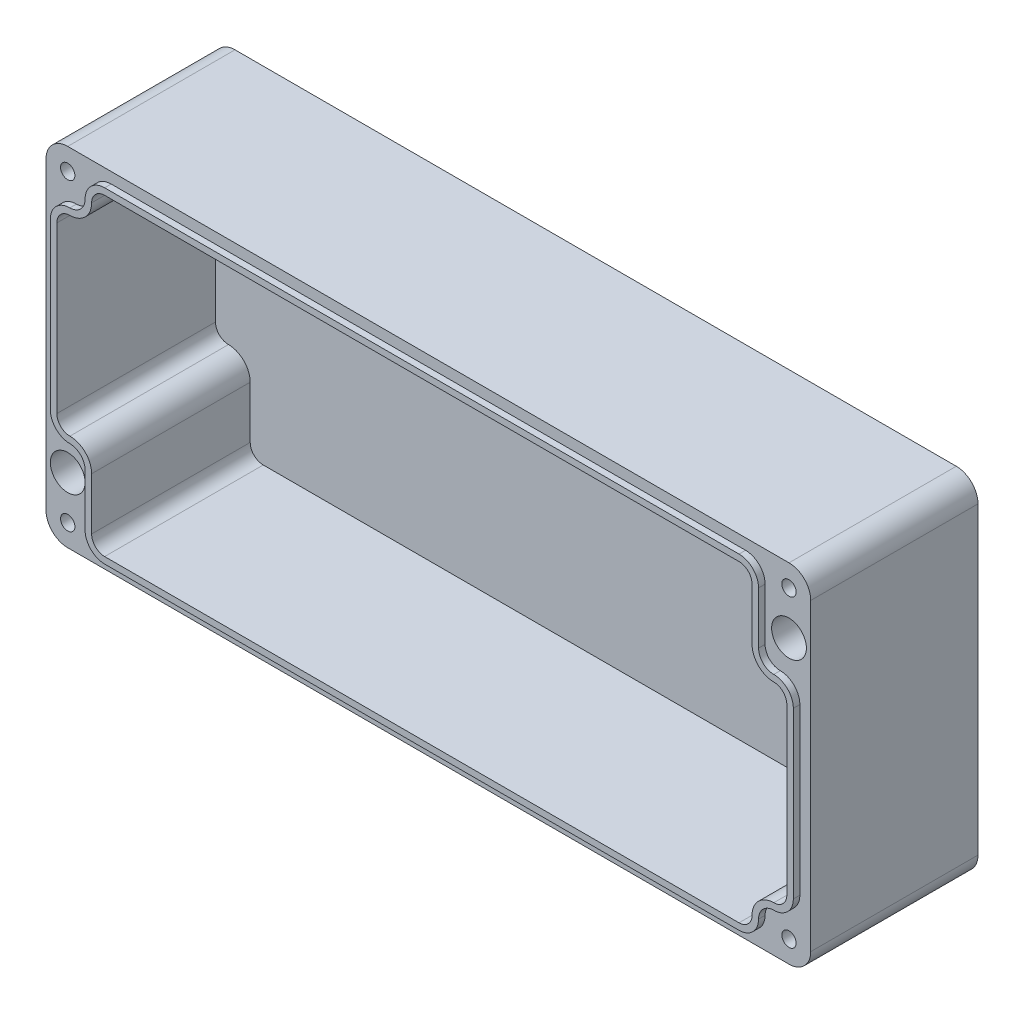
from build123d import *

# Parameters (mm, degrees)
SKETCH1_W                                   = 176
SKETCH1_H                                   = 80
BOSS_EXTRUDE1_DEPTH                         = 38.5
SKETCH2_W                                   = 168
SKETCH2_H                                   = 72
CUT_EXTRUDE1_DEPTH                          = 35
FILLET2_R                                   = 5
SKETCH8_W                                   = 8
SKETCH8_H                                   = 20
SKETCH8_H_2                                 = 8
BOSS_EXTRUDE2_DEPTH                         = 35
FILLET4_R                                   = 3
FILLET5_R                                   = 5
M4_TAPPED_HOLE1_D                           = 3.3
M4_TAPPED_HOLE1_DEPTH                       = 11.5
M4_TAPPED_HOLE1_TIP                         = 0.991420021
BOSS_EXTRUDE3_START                         = 1.5
BOSS_EXTRUDE3_DEPTH                         = 1.5
CBORE_FOR_M4_CHEESE_HEAD_SCREW1_D           = 4.5
CBORE_FOR_M4_CHEESE_HEAD_SCREW1_CBORE_D     = 8
CBORE_FOR_M4_CHEESE_HEAD_SCREW1_CBORE_DEPTH = 30


with BuildPart() as part:
    # Sketch1 → Boss-Extrude1 (new body)
    with BuildSketch(Plane.XY):
        Rectangle(SKETCH1_W, SKETCH1_H)
    extrude(amount=BOSS_EXTRUDE1_DEPTH)

    # Sketch2 → Cut-Extrude1 (cut)
    with BuildSketch(Plane.XY.offset(38.5)):
        Rectangle(SKETCH2_W, SKETCH2_H)
    extrude(amount=-CUT_EXTRUDE1_DEPTH, mode=Mode.SUBTRACT)

    # Fillet2
    fillet2_edges = [part.edges().sort_by_distance(p)[0] for p in [
        (-88, 40, 19.25),
        (88, 40, 19.25),
        (88, -40, 19.25),
        (-88, -40, 19.25),
    ]]
    fillet(fillet2_edges, radius=FILLET2_R)

    # Sketch8 → Boss-Extrude2 (add)
    with BuildSketch(Plane.XY.offset(3.5)):
        with Locations((80, 26)):
            Rectangle(SKETCH8_W, SKETCH8_H)
        with Locations((80, -32)):
            Rectangle(SKETCH8_W, SKETCH8_H_2)
        with Locations((-80, -26)):
            Rectangle(SKETCH8_W, SKETCH8_H)
        with Locations((-80, 32)):
            Rectangle(SKETCH8_W, SKETCH8_H_2)
    extrude(amount=BOSS_EXTRUDE2_DEPTH)

    # Fillet4
    fillet4_edges = [part.edges().sort_by_distance(p)[0] for p in [
        (76, 36, 21),
        (84, 16, 21),
        (84, -28, 21),
        (76, -36, 21),
        (-76, -36, 21),
        (-84, -16, 21),
        (-84, 28, 21),
        (-76, 36, 21),
    ]]
    fillet(fillet4_edges, radius=FILLET4_R)

    # Fillet5
    fillet5_edges = [part.edges().sort_by_distance(p)[0] for p in [
        (-76, -16, 21),
        (76, -28, 21),
        (76, 16, 21),
        (-76, 28, 21),
    ]]
    fillet(fillet5_edges, radius=FILLET5_R - 0.0001)  # a hair under: the kernel refuses the full size

    # M4 Tapped Hole1
    with Locations(Plane.XY.offset(38.5)):
        with Locations((-83, -35), (83, 35), (-83, 35), (83, -35)):
            Hole(M4_TAPPED_HOLE1_D / 2, depth=M4_TAPPED_HOLE1_DEPTH)
            with Locations((0, 0, -(M4_TAPPED_HOLE1_DEPTH + M4_TAPPED_HOLE1_TIP / 2))):  # 118° drill point
                Cone(0, M4_TAPPED_HOLE1_D / 2, M4_TAPPED_HOLE1_TIP, mode=Mode.SUBTRACT)

    # Sketch9 → Boss-Extrude3 (add)
    with BuildSketch(Plane.XY.offset(38.5).offset(BOSS_EXTRUDE3_START)):
        with BuildLine():
            Line((73, 37.5), (-73, 37.5))
            ThreePointArc((-73, 37.5), (-76.181980515, 36.181980515), (-77.5, 33))
            ThreePointArc((-77.5, 33), (-78.525126266, 30.525126266), (-81, 29.5))
            ThreePointArc((-81, 29.5), (-84.181980515, 28.181980515), (-85.5, 25))
            Line((-85.5, 25), (-85.5, -13))
            ThreePointArc((-85.5, -13), (-84.181980515, -16.181980515), (-81, -17.5))
            ThreePointArc((-81, -17.5), (-78.525126266, -18.525126266), (-77.5, -21))
            Line((-77.5, -21), (-77.5, -33))
            ThreePointArc((-77.5, -33), (-76.181980515, -36.181980515), (-73, -37.5))
            Line((-73, -37.5), (73, -37.5))
            ThreePointArc((73, -37.5), (76.181980515, -36.181980515), (77.5, -33))
            ThreePointArc((77.5, -33), (78.525126266, -30.525126266), (81, -29.5))
            ThreePointArc((81, -29.5), (84.181980515, -28.181980515), (85.5, -25))
            Line((85.5, -25), (85.5, 13))
            ThreePointArc((85.5, 13), (84.181980515, 16.181980515), (81, 17.5))
            ThreePointArc((81, 17.5), (78.525126266, 18.525126266), (77.5, 21))
            Line((77.5, 21), (77.5, 33))
            ThreePointArc((77.5, 33), (76.181980515, 36.181980515), (73, 37.5))
        make_face()
        with BuildLine():
            Line((73, 36), (-73, 36))
            ThreePointArc((-73, 36), (-75.121320344, 35.121320344), (-76, 33))
            ThreePointArc((-76, 33), (-77.464466094, 29.464466094), (-81, 28))
            ThreePointArc((-81, 28), (-83.121320344, 27.121320344), (-84, 25))
            Line((-84, 25), (-84, -13))
            ThreePointArc((-84, -13), (-83.121320344, -15.121320344), (-81, -16))
            ThreePointArc((-81, -16), (-77.464466094, -17.464466094), (-76, -21))
            Line((-76, -21), (-76, -33))
            ThreePointArc((-76, -33), (-75.121320344, -35.121320344), (-73, -36))
            Line((-73, -36), (73, -36))
            ThreePointArc((73, -36), (75.121320344, -35.121320344), (76, -33))
            ThreePointArc((76, -33), (77.464466094, -29.464466094), (81, -28))
            ThreePointArc((81, -28), (83.121320344, -27.121320344), (84, -25))
            Line((84, -25), (84, 13))
            ThreePointArc((84, 13), (83.121320344, 15.121320344), (81, 16))
            ThreePointArc((81, 16), (77.464466094, 17.464466094), (76, 21))
            Line((76, 21), (76, 33))
            ThreePointArc((76, 33), (75.121320344, 35.121320344), (73, 36))
        make_face(mode=Mode.SUBTRACT)
    extrude(amount=-BOSS_EXTRUDE3_DEPTH)

    # CBORE for M4 Cheese Head Screw1 (through all)
    with Locations(Plane.XY.offset(38.5)):
        with Locations((83, 25), (-83, -25)):
            CounterBoreHole(CBORE_FOR_M4_CHEESE_HEAD_SCREW1_D / 2, CBORE_FOR_M4_CHEESE_HEAD_SCREW1_CBORE_D / 2, CBORE_FOR_M4_CHEESE_HEAD_SCREW1_CBORE_DEPTH)


solid = part.part
